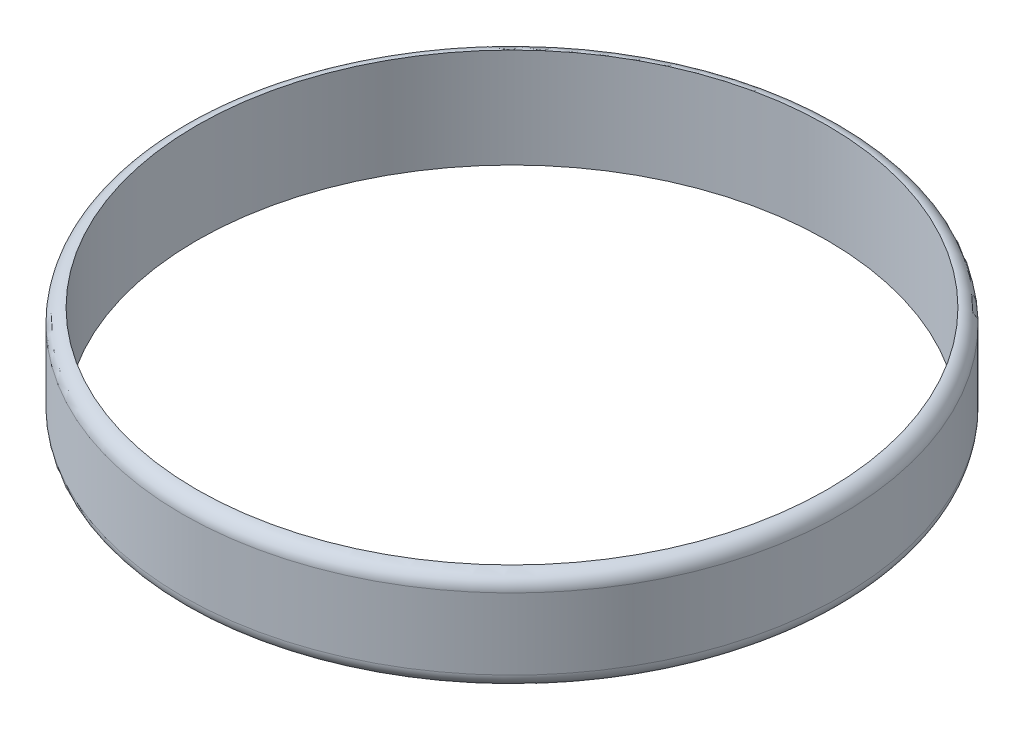
from build123d import *

# Parameters (mm, degrees)
ESBO_O1_R                = 69.5
ESBO_O1_R_2              = 66.5
RESSALTO_EXTRUS_O1_DEPTH = 10.5
FILETE1_R                = 3


with BuildPart() as part:
    # Esboço1 → Ressalto-extrusão1 (new, symmetric)
    with BuildSketch(Plane(origin=(0, 0, 0), x_dir=(1, 0, 0), z_dir=(0, 1, 0))):
        with Locations(Location((0, 0, 0), (0, 0, 90))):
            Circle(ESBO_O1_R)
        with Locations(Location((0, 0, 0), (0, 0, 90))):
            Circle(ESBO_O1_R_2, mode=Mode.SUBTRACT)
    extrude(amount=RESSALTO_EXTRUS_O1_DEPTH, both=True)

    # Filete1
    filete1_edges = [part.edges().sort_by_distance(p)[0] for p in [
        (0, -10.5, 69.5),
        (0, 10.5, 69.5),
    ]]
    fillet(filete1_edges, radius=FILETE1_R - 0.0001)  # a hair under: the kernel refuses the full size


solid = part.part
